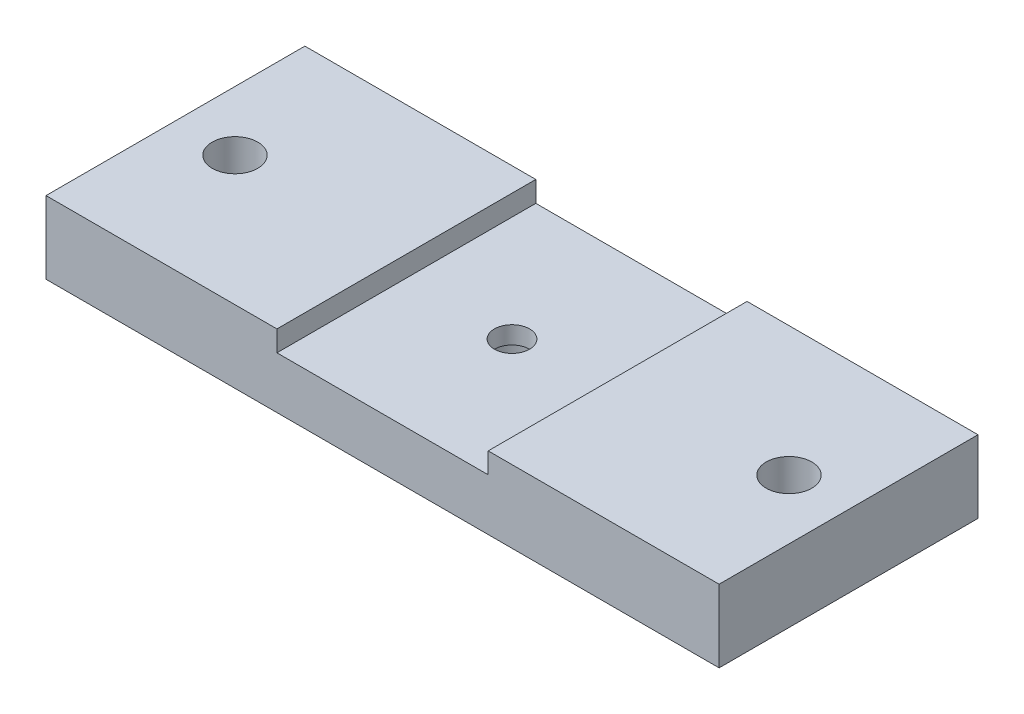
from build123d import *

# Parameters (mm, degrees)
SKETCH1_W           = 65
SKETCH1_H           = 25
BOSS_EXTRUDE1_DEPTH = 7
SKETCH2_W           = 20.4
SKETCH2_H           = 25
CUT_EXTRUDE1_DEPTH  = 2
SKETCH3_R           = 1.7
CUT_EXTRUDE2_DEPTH  = 70.992856778
SKETCH4_R           = 3
CUT_EXTRUDE3_DEPTH  = 3.3
SKETCH5_R           = 2.2
CUT_EXTRUDE4_DEPTH  = 70.992856778
CHAMFER1_SIZE       = 1


with BuildPart() as part:
    # Sketch1 → Boss-Extrude1 (new body)
    with BuildSketch(Plane(origin=(0, 0, 0), x_dir=(1, 0, 0), z_dir=(0, 1, 0))):
        with Locations((32.5, 12.5)):
            Rectangle(SKETCH1_W, SKETCH1_H)
    extrude(amount=BOSS_EXTRUDE1_DEPTH)

    # Sketch2 → Cut-Extrude1 (cut)
    with BuildSketch(Plane(origin=(0, 7, 0), x_dir=(1, 0, 0), z_dir=(0, 1, 0))):
        with Locations((32.5, 12.5)):
            Rectangle(SKETCH2_W, SKETCH2_H)
    extrude(amount=-CUT_EXTRUDE1_DEPTH, mode=Mode.SUBTRACT)

    # Sketch3 → Cut-Extrude2 (cut, through all)
    with BuildSketch(Plane(origin=(0, 0, 0), x_dir=(-1, 0, 0), z_dir=(0, -1, 0))):
        with Locations((-32.5, 12.5)):
            Circle(SKETCH3_R)
    extrude(amount=-CUT_EXTRUDE2_DEPTH, mode=Mode.SUBTRACT)

    # Sketch4 → Cut-Extrude3 (cut)
    with BuildSketch(Plane(origin=(0, 0, 0), x_dir=(-1, 0, 0), z_dir=(0, -1, 0))):
        with Locations((-32.5, 12.5)):
            Circle(SKETCH4_R)
    extrude(amount=-CUT_EXTRUDE3_DEPTH, mode=Mode.SUBTRACT)

    # Sketch5 → Cut-Extrude4 (cut, through all)
    with BuildSketch(Plane(origin=(0, 0, 0), x_dir=(-1, 0, 0), z_dir=(0, -1, 0))):
        with Locations((-5.75, 12.5)):
            Circle(SKETCH5_R)
        with Locations((-59.25, 12.5)):
            Circle(SKETCH5_R)
    extrude(amount=-CUT_EXTRUDE4_DEPTH, mode=Mode.SUBTRACT)

    # Chamfer1
    chamfer1_edges = [part.edges().sort_by_distance(p)[0] for p in [
        (61.45, 0, -12.5),
        (7.95, 0, -12.5),
    ]]
    chamfer(chamfer1_edges, length=CHAMFER1_SIZE)


solid = part.part
